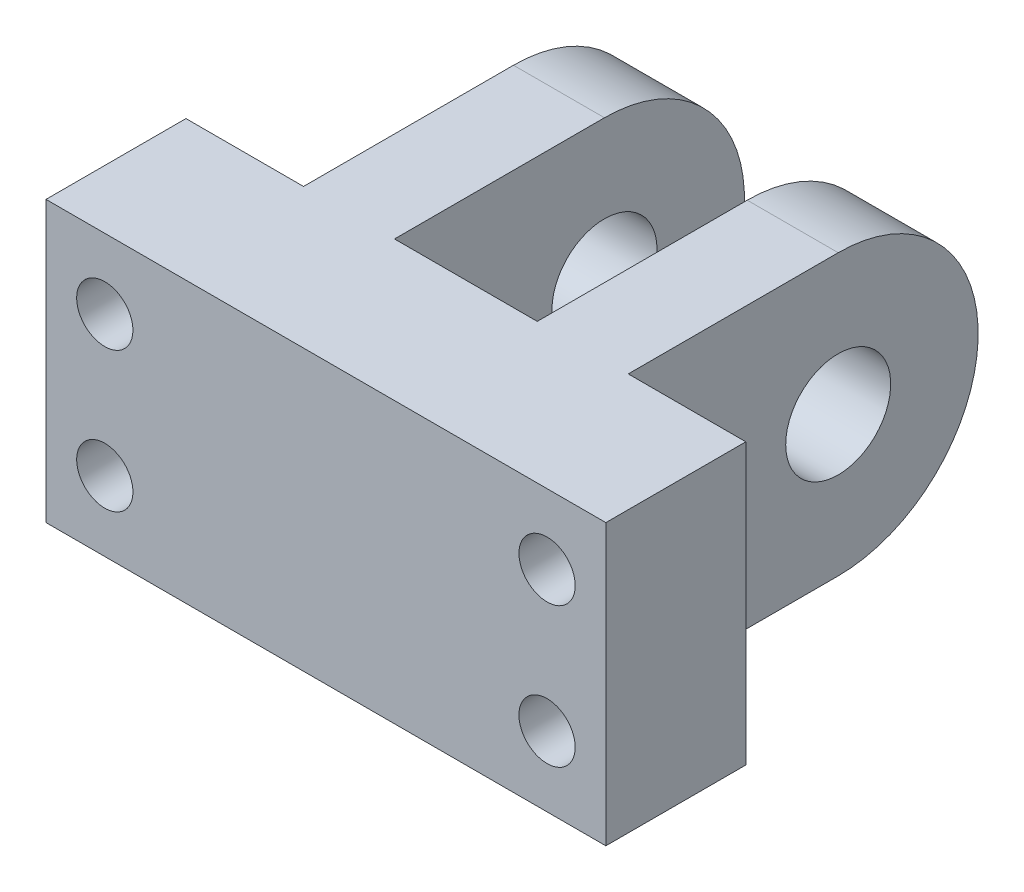
from build123d import *

# Parameters (mm, degrees)
SKETCH1_R                                       = 4.7625
BOSS_EXTRUDE1_DEPTH                             = 50.8
CUT_EXTRUDE1_DEPTH                              = 73.122135992
CBORE_FOR_10_SOCKET_HEAD_CAP_SCREW1_D           = 5.1054
CBORE_FOR_10_SOCKET_HEAD_CAP_SCREW1_CBORE_D     = 9.525
CBORE_FOR_10_SOCKET_HEAD_CAP_SCREW1_CBORE_DEPTH = 4.826


with BuildPart() as part:
    # Sketch1 → Boss-Extrude1 (new body)
    with BuildSketch(Plane(origin=(0, 0, 0), x_dir=(0, 0, -1), z_dir=(1, 0, 0))):
        with BuildLine():
            Line((0, 0), (31.75, 0))
            ThreePointArc((31.75, 0), (44.45, 12.7), (31.75, 25.4))
            Line((31.75, 25.4), (0, 25.4))
            Line((0, 25.4), (0, 0))
        make_face()
        with Locations((31.75, 12.7)):
            Circle(SKETCH1_R, mode=Mode.SUBTRACT)
    extrude(amount=BOSS_EXTRUDE1_DEPTH)

    # Sketch2 → Cut-Extrude1 (cut, through all)
    with BuildSketch(Plane.XZ):
        Polygon((50.8, -12.7), (40.132, -12.7), (40.132, -44.45), (31.877, -44.45), (31.877, -12.7), (18.923, -12.7), (18.923, -44.45), (10.668, -44.45), (10.668, -12.7), (0, -12.7), (0, -50.8), (50.8, -50.8), align=None)
    extrude(amount=-CUT_EXTRUDE1_DEPTH, mode=Mode.SUBTRACT)

    # CBORE for #10 Socket Head Cap Screw1 (through all)
    with Locations(Plane(origin=(0, 0, -12.7), x_dir=(-1, 0, 0), z_dir=(0, 0, -1))):
        with Locations((-45.466, 6.35), (-45.466, 19.05), (-5.334, 19.05), (-5.334, 6.35)):
            CounterBoreHole(CBORE_FOR_10_SOCKET_HEAD_CAP_SCREW1_D / 2, CBORE_FOR_10_SOCKET_HEAD_CAP_SCREW1_CBORE_D / 2, CBORE_FOR_10_SOCKET_HEAD_CAP_SCREW1_CBORE_DEPTH)


solid = part.part
